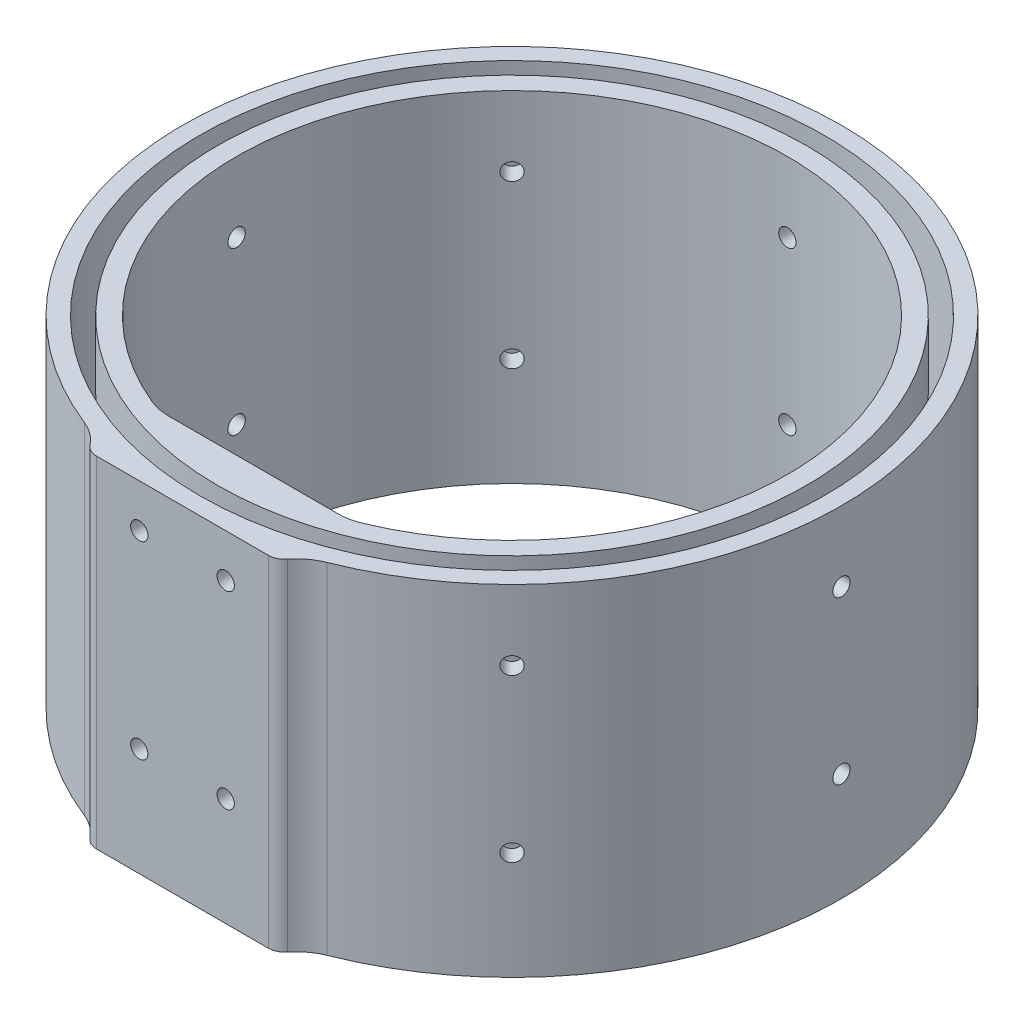
from build123d import *

# Parameters (mm, degrees)
SKETCH1_R                       = 61
SKETCH1_R_2                     = 51.00000000000001
BOSS_EXTRUDE1_DEPTH             = 3
SKETCH3_R                       = 57.8
SKETCH3_R_2                     = 54.49999999999999
BOSS_EXTRUDE2_DEPTH             = 60
BOSS_EXTRUDE2_DIRECTION_2_REACH = 88.319
CUT_EXTRUDE1_REACH              = 152.246
SKETCH5_R                       = 1.5999999999999992
SKETCH5_R_2                     = 1.6000000000000008
SKETCH5_R_3                     = 1.6
SKETCH5_R_4                     = 1.6000000000000019
CUT_EXTRUDE3_REACH              = 152.246
CUT_EXTRUDE3_END_RADIUS         = 51.00000000000001
SKETCH6_R                       = 1.5999999999999999
SKETCH6_R_2                     = 1.5999999999999988
CIRPATTERN1_COUNT               = 8
FILLET1_R                       = 10
FILLET2_R                       = 3


with BuildPart() as part:
    # Sketch1 → Boss-Extrude1 (new body)
    with BuildSketch(Plane(origin=(0, 0, 0), x_dir=(1, 0, 0), z_dir=(0, 1, 0))):
        with Locations(Location((0, 0, 0), (0, 0, 270))):
            Circle(SKETCH1_R)
        with Locations(Location((0, 0, 0), (0, 0, 270))):
            Circle(SKETCH1_R_2, mode=Mode.SUBTRACT)
    extrude(amount=BOSS_EXTRUDE1_DEPTH)

    # Sketch3 → Boss-Extrude2 (add)
    # profile 1 of 2: a face of its own
    with BuildSketch(Plane(origin=(0, 3, 0), x_dir=(1, 0, 0), z_dir=(0, 1, 0))):
        with BuildLine():
            Line((-17.5, -58.43586227651646), (-17.5, -61))
            Line((-17.5, -61), (17.5, -61))
            Line((17.500000000000004, -61), (17.5, -58.43586227651646))
            ThreePointArc((17.500000000000004, -58.43586227651647), (2.487e-14, 61.00000000000001), (-17.500000000000046, -58.43586227651646))
        make_face()
        with Locations(Location((0, 0, 0), (0, 0, 270))):
            Circle(SKETCH3_R, mode=Mode.SUBTRACT)
    # profile 2 of 2: a face of its own
    with BuildSketch(Plane(origin=(0, 3, 0), x_dir=(1, 0, 0), z_dir=(0, 1, 0))):
        with Locations(Location((0, 0, 0), (0, 0, 270))):
            Circle(SKETCH3_R_2)
        with BuildLine():
            Line((17.5, -47.90354892907205), (-17.5, -47.90354892907205))
            ThreePointArc((-17.500000000000004, -47.90354892907206), (-7.11e-15, 51.00000000000001), (17.50000000000001, -47.90354892907206))
        make_face(mode=Mode.SUBTRACT)
    extrude(amount=BOSS_EXTRUDE2_DEPTH)

    # Boss-Extrude2 direction 2: up to this face of the body (flat: up to its plane)
    boss_extrude2_direction_2_end = Plane(part.part.faces().sort_by_distance((0, 0, -59.274659454))[0])
    # Sketch3 → Boss-Extrude2 direction 2 (add, up to the picked face)
    with BuildSketch(Plane(origin=(0, 3, 0), x_dir=(1, 0, 0), z_dir=(0, 1, 0)), mode=Mode.PRIVATE) as boss_extrude2_direction_2_sk1:
        with BuildLine():
            Line((-17.5, -58.43586227651646), (-17.5, -61))
            Line((-17.5, -61), (17.5, -61))
            Line((17.500000000000004, -61), (17.5, -58.43586227651646))
            ThreePointArc((17.500000000000004, -58.43586227651647), (2.487e-14, 61.00000000000001), (-17.500000000000046, -58.43586227651646))
        make_face()
        with Locations(Location((0, 0, 0), (0, 0, 270))):
            Circle(SKETCH3_R, mode=Mode.SUBTRACT)
    boss_extrude2_direction_2_tool1 = split(extrude(boss_extrude2_direction_2_sk1.sketch, amount=-BOSS_EXTRUDE2_DIRECTION_2_REACH, mode=Mode.PRIVATE), bisect_by=boss_extrude2_direction_2_end, keep=Keep.BOTH, mode=Mode.PRIVATE)
    # Sketch3 → Boss-Extrude2 direction 2 (add, up to the picked face)
    with BuildSketch(Plane(origin=(0, 3, 0), x_dir=(1, 0, 0), z_dir=(0, 1, 0)), mode=Mode.PRIVATE) as boss_extrude2_direction_2_sk2:
        with Locations(Location((0, 0, 0), (0, 0, 270))):
            Circle(SKETCH3_R_2)
        with BuildLine():
            Line((17.5, -47.90354892907205), (-17.5, -47.90354892907205))
            ThreePointArc((-17.500000000000004, -47.90354892907206), (-7.11e-15, 51.00000000000001), (17.50000000000001, -47.90354892907206))
        make_face(mode=Mode.SUBTRACT)
    boss_extrude2_direction_2_tool2 = split(extrude(boss_extrude2_direction_2_sk2.sketch, amount=-BOSS_EXTRUDE2_DIRECTION_2_REACH, mode=Mode.PRIVATE), bisect_by=boss_extrude2_direction_2_end, keep=Keep.BOTH, mode=Mode.PRIVATE)
    add(boss_extrude2_direction_2_tool1.solids().sort_by(Axis((-15.774659, 3, 59.717931), (0, -1, 0)))[0])
    add(boss_extrude2_direction_2_tool2.solids().sort_by(Axis((0, 3, -52.958507), (0, -1, 0)))[0])

    # Cut-Extrude1: up to this face of the body (flat: up to its plane)
    cut_extrude1_end = Plane(part.part.faces().sort_by_distance((0, 33, 47.903548929))[0])
    # Sketch5 → Cut-Extrude1 (cut, up to the picked face)
    with BuildSketch(Plane.XY.offset(61), mode=Mode.PRIVATE) as cut_extrude1_sk1:
        with Locations((-8, 55.00000000000001)):
            Circle(SKETCH5_R)
    cut_extrude1_tool1 = split(extrude(cut_extrude1_sk1.sketch, amount=-CUT_EXTRUDE1_REACH, mode=Mode.PRIVATE), bisect_by=cut_extrude1_end, keep=Keep.BOTH, mode=Mode.PRIVATE)
    # Sketch5 → Cut-Extrude1 (cut, up to the picked face)
    with BuildSketch(Plane.XY.offset(61), mode=Mode.PRIVATE) as cut_extrude1_sk2:
        with Locations((8, 55.00000000000001)):
            Circle(SKETCH5_R_2)
    cut_extrude1_tool2 = split(extrude(cut_extrude1_sk2.sketch, amount=-CUT_EXTRUDE1_REACH, mode=Mode.PRIVATE), bisect_by=cut_extrude1_end, keep=Keep.BOTH, mode=Mode.PRIVATE)
    # Sketch5 → Cut-Extrude1 (cut, up to the picked face)
    with BuildSketch(Plane.XY.offset(61), mode=Mode.PRIVATE) as cut_extrude1_sk3:
        with Locations((-8.000000000000007, 20.000000000000004)):
            Circle(SKETCH5_R_3)
    cut_extrude1_tool3 = split(extrude(cut_extrude1_sk3.sketch, amount=-CUT_EXTRUDE1_REACH, mode=Mode.PRIVATE), bisect_by=cut_extrude1_end, keep=Keep.BOTH, mode=Mode.PRIVATE)
    # Sketch5 → Cut-Extrude1 (cut, up to the picked face)
    with BuildSketch(Plane.XY.offset(61), mode=Mode.PRIVATE) as cut_extrude1_sk4:
        with Locations((8, 20.000000000000004)):
            Circle(SKETCH5_R_4)
    cut_extrude1_tool4 = split(extrude(cut_extrude1_sk4.sketch, amount=-CUT_EXTRUDE1_REACH, mode=Mode.PRIVATE), bisect_by=cut_extrude1_end, keep=Keep.BOTH, mode=Mode.PRIVATE)
    add(cut_extrude1_tool1.solids().sort_by(Axis((-8, 55, 61), (0, 0, -1)))[0], mode=Mode.SUBTRACT)
    add(cut_extrude1_tool2.solids().sort_by(Axis((8, 55, 61), (0, 0, -1)))[0], mode=Mode.SUBTRACT)
    add(cut_extrude1_tool3.solids().sort_by(Axis((-8, 20, 61), (0, 0, -1)))[0], mode=Mode.SUBTRACT)
    add(cut_extrude1_tool4.solids().sort_by(Axis((8, 20, 61), (0, 0, -1)))[0], mode=Mode.SUBTRACT)

    # Cut-Extrude3: up to this cylinder (the profile starts outside it)
    cut_extrude3_end = Plane(origin=(0, 35, 0), z_dir=(0, -1, 0)) * Cylinder(CUT_EXTRUDE3_END_RADIUS, 437.492, mode=Mode.PRIVATE)
    # Sketch6 → Cut-Extrude3 (cut, up to the surface)
    with BuildSketch(Plane.ZY.offset(61), mode=Mode.PRIVATE) as cut_extrude3_sk1:
        with Locations((0, 20)):
            Circle(SKETCH6_R)
    cut_extrude3_tool1 = extrude(cut_extrude3_sk1.sketch, amount=-CUT_EXTRUDE3_REACH, mode=Mode.PRIVATE) - cut_extrude3_end
    # Sketch6 → Cut-Extrude3 (cut, up to the surface)
    with BuildSketch(Plane.ZY.offset(61), mode=Mode.PRIVATE) as cut_extrude3_sk2:
        with Locations((0, 50)):
            Circle(SKETCH6_R_2)
    cut_extrude3_tool2 = extrude(cut_extrude3_sk2.sketch, amount=-CUT_EXTRUDE3_REACH, mode=Mode.PRIVATE) - cut_extrude3_end
    cut_extrude3 = cut_extrude3_tool1.solids().sort_by_distance((-61, 20, 0))[0] + cut_extrude3_tool2.solids().sort_by_distance((-61, 50, 0))[0]
    add(cut_extrude3, mode=Mode.SUBTRACT)

    # CirPattern1: Cut-Extrude3 ×8 about axis, 1 skipped
    cirpattern1_axis = Axis((0, 0, 0), (0, -1, 0))
    add([cut_extrude3.rotate(cirpattern1_axis, i * 360 / CIRPATTERN1_COUNT) for i in range(1, CIRPATTERN1_COUNT) if i not in (6,)], mode=Mode.SUBTRACT)

    # Fillet1
    # the kernel refuses this fillet: 10 mm, written as the material it adds along each edge
    with BuildSketch(Plane(origin=(-17.50000000000002, 0, 58.43586227651647), x_dir=(-0.9446952516229686, 0, -0.3279495106887889), z_dir=(0, 1, 0))) as fillet1_piece_1:
        with BuildLine():
            CenterArc((5.695141161727597, 9.990688205602074), FILLET1_R, 229.18605041304588, 38.341155089480765)
            Line((-0.840907711755121, 2.422328731882204), (-0.9716286892247759, 2.2709615424078033))
            ThreePointArc((-0.9716286892247759, 2.2709615424078033), (-0.6093929062021569, 1.1455744638033434), (-0.18893905032459304, -0.06558990213775755))
            Line((-0.18893905032459304, -0.06558990213775755), (0.00862900176019262, -0.1998137641120389))
            ThreePointArc((0.00862900176019262, -0.1998137641120389), (2.6318455368590086, -0.1431980541726762), (5.255062071957752, -0.19981376411204238))
            Line((5.255062071957752, -0.19981376411204238), (5.263691073717943, -1.2e-16))
        make_face()
    extrude(amount=63)
    with BuildSketch(Plane(origin=(17.5, 63, 58.43586227651646), x_dir=(0.9446952516229696, 0, -0.3279495106887856), z_dir=(0, -1, 0))) as fillet1_piece_2:
        with BuildLine():
            CenterArc((5.695141161727662, 9.990688205602071), FILLET1_R, 229.18605041304562, 38.34115508948082)
            Line((-0.8409077117550869, 2.4223287318822306), (-0.9716286892247422, 2.2709615424078304))
            ThreePointArc((-0.9716286892247422, 2.2709615424078304), (-0.609392906202135, 1.145574463803359), (-0.18893905032459327, -0.06558990213775688))
            Line((-0.18893905032459327, -0.06558990213775688), (0.00862900176019192, -0.1998137641120389))
            ThreePointArc((0.00862900176019192, -0.1998137641120389), (2.631845536858985, -0.14319805417266313), (5.255062071957782, -0.19981376411204224))
            Line((5.255062071957782, -0.19981376411204224), (5.2636910737179745, -2e-17))
        make_face()
    extrude(amount=63)
    with BuildSketch(Plane(origin=(17.500000000000004, 3, 47.90354892907206), x_dir=(-1, 0, -3.8e-15), z_dir=(0, 1, 0))) as fillet1_piece_3:
        with BuildLine():
            CenterArc((1.8692297508586975, -10), FILLET1_R, 90.00000000000021, 22.410406843138105)
            Line((-1.9431532367367914, -0.7552319685190344), (-2.0194008964887025, -0.5703366078894169))
            ThreePointArc((-2.0194008964887025, -0.5703366078894169), (-1.0478887230632374, -0.18127086193800013), (-0.0686274509803944, 0.18785705462381205))
            Line((-0.0686274509803944, 0.18785705462381205), (-7.6e-16, 0.20000000000000284))
            Line((-7.6e-16, 0.20000000000000284), (1.8692297508586588, 0.20000000000000284))
            Line((1.8692297508586588, 0.20000000000000284), (1.8692297508586595, 0))
        make_face()
    extrude(amount=60)
    with BuildSketch(Plane(origin=(-17.500000000000004, 3, 47.90354892907206), x_dir=(1, 0, -3.8e-15), z_dir=(0, 1, 0))) as fillet1_piece_4:
        with BuildLine():
            CenterArc((1.869229750858685, 10), FILLET1_R, 247.58959315686167, 22.410406843138162)
            Line((-1.9431532367368092, 0.7552319685190344), (-2.0194008964887202, 0.5703366078894169))
            ThreePointArc((-2.0194008964887202, 0.5703366078894169), (-1.0478887230632516, 0.18127086193800013), (-0.0686274509803944, -0.18785705462381205))
            Line((-0.0686274509803944, -0.18785705462381205), (-7.6e-16, -0.20000000000000284))
            Line((-7.6e-16, -0.20000000000000284), (1.8692297508586464, -0.20000000000000284))
            Line((1.8692297508586464, -0.20000000000000284), (1.869229750858647, 0))
        make_face()
    extrude(amount=60)
    with BuildSketch(Plane(origin=(-17.500000000000004, 3, 47.90354892907206), x_dir=(1, 0, -3.8e-15), z_dir=(0, -1, 0))) as fillet1_piece_5:
        with BuildLine():
            CenterArc((1.8692297508587206, -10), FILLET1_R, 90.00000000000021, 22.410406843138162)
            Line((-1.9431532367367772, -0.7552319685190344), (-2.0194008964886883, -0.5703366078894169))
            ThreePointArc((-2.0194008964886883, -0.5703366078894169), (-1.0478887230632303, -0.18127086193800013), (-0.0686274509803944, 0.18785705462381205))
            Line((-0.0686274509803944, 0.18785705462381205), (-7.6e-16, 0.20000000000000284))
            Line((-7.6e-16, 0.20000000000000284), (1.869229750858682, 0.20000000000000284))
            Line((1.869229750858682, 0.20000000000000284), (1.8692297508586826, 0))
        make_face()
    extrude(amount=3)
    with BuildSketch(Plane(origin=(17.500000000000004, 3, 47.90354892907206), x_dir=(-1, 0, -3.8e-15), z_dir=(0, -1, 0))) as fillet1_piece_6:
        with BuildLine():
            CenterArc((1.8692297508587117, 10), FILLET1_R, 247.58959315686175, 22.41040684313805)
            Line((-1.9431532367367665, 0.7552319685190273), (-2.0194008964886776, 0.5703366078894098))
            ThreePointArc((-2.0194008964886776, 0.5703366078894098), (-1.0478887230632268, 0.18127086193800723), (-0.0686274509803944, -0.18785705462381205))
            Line((-0.0686274509803944, -0.18785705462381205), (-7.6e-16, -0.20000000000000284))
            Line((-7.6e-16, -0.20000000000000284), (1.869229750858673, -0.20000000000000284))
            Line((1.869229750858673, -0.20000000000000284), (1.8692297508586737, 0))
        make_face()
    extrude(amount=3)

    # Fillet2
    fillet2_edges = [part.edges().sort_by_distance(p)[0] for p in [
        (17.5, 31.5, 61),
        (-17.5, 31.5, 61),
    ]]
    fillet(fillet2_edges, radius=FILLET2_R)


solid = part.part
